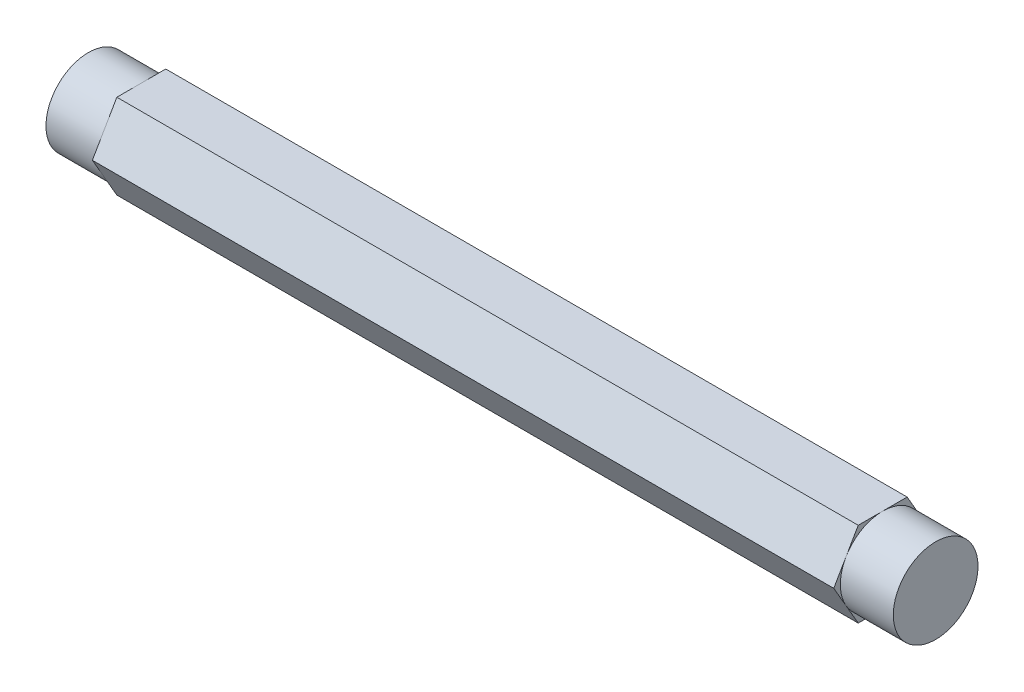
from build123d import *

# Parameters (mm, degrees)
BOSS_EXTRUDE1_DEPTH     = 63.5
SKETCH3_R               = 8.89
SKETCH3_R_2             = 6.35
CUT_EXTRUDE_THIN1_DEPTH = 7.9375


with BuildPart() as part:
    # Sketch2 → Boss-Extrude1 (new, symmetric)
    with BuildSketch(Plane(origin=(0, 0, 0), x_dir=(0, 0, -1), z_dir=(1, 0, 0))):
        Polygon((7.332348419, 0), (3.666174209, 6.35), (-3.666174209, 6.35), (-7.332348419, 0), (-3.666174209, -6.35), (3.666174209, -6.35), align=None)
    extrude(amount=BOSS_EXTRUDE1_DEPTH, both=True)

    # Sketch3 → Cut-Extrude-Thin1 (cut)
    with BuildSketch(Plane(origin=(63.5, 0, 0), x_dir=(0, 0, -1), z_dir=(1, 0, 0))):
        Circle(SKETCH3_R)
        Circle(SKETCH3_R_2, mode=Mode.SUBTRACT)
    cut_extrude_thin1 = extrude(amount=-CUT_EXTRUDE_THIN1_DEPTH, mode=Mode.SUBTRACT)

    # Mirror1: Cut-Extrude-Thin1 across plane
    add(cut_extrude_thin1.mirror(Plane(origin=(0, 0, 0), x_dir=(0, 0, 1), z_dir=(1, 0, 0))), mode=Mode.SUBTRACT)


solid = part.part
